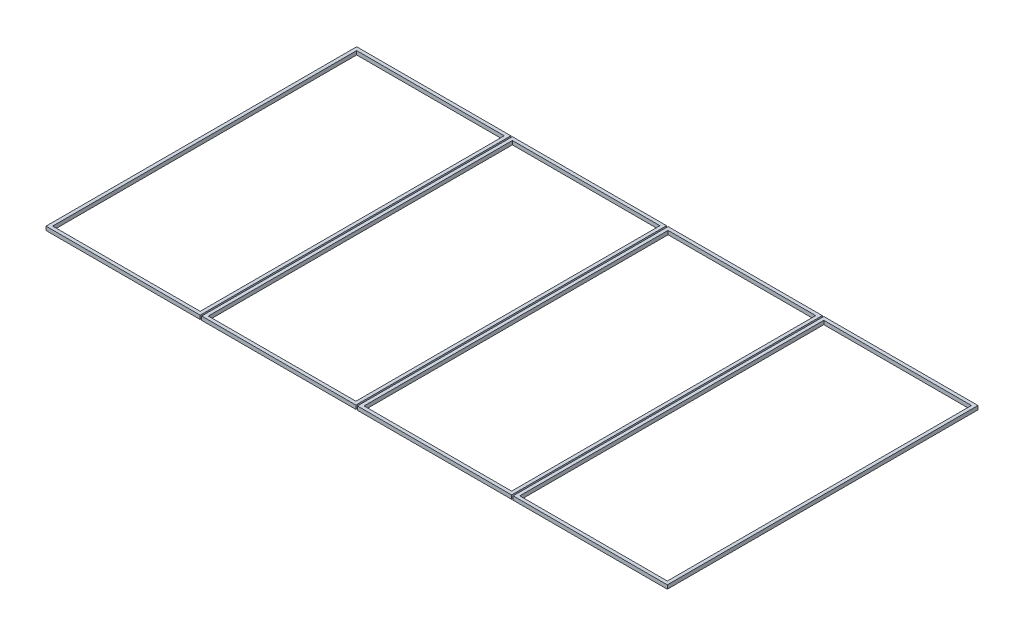
from build123d import *

# Parameters (mm, degrees)
SKETCH1_W            = 579.5
SKETCH1_H            = 1194
BOSS_EXTRU_1_DEPTH   = 15
BOSS_EXTRU_1_2_DEPTH = 15
BOSS_EXTRU_1_3_DEPTH = 15
BOSS_EXTRU_1_4_DEPTH = 15


with BuildPart() as part:
    # Sketch1 → Boss.-Extru.1 (new body)
    with BuildSketch(Plane(origin=(0, 0, 0), x_dir=(1, 0, 0), z_dir=(0, 1, 0))):
        Polygon((0, 0), (0, 1220), (605.5, 1220), (605.5, 0), (592.5, 0), (13, 0), align=None)
        with Locations((302.75, 610)):
            Rectangle(SKETCH1_W, SKETCH1_H, mode=Mode.SUBTRACT)
    extrude(amount=BOSS_EXTRU_1_DEPTH)


with BuildPart() as body_2:
    # Sketch1 → Boss.-Extru.1 2 (new body)
    with BuildSketch(Plane(origin=(0, 0, 0), x_dir=(1, 0, 0), z_dir=(0, 1, 0))):
        Polygon((2440, 0), (2440, 1220), (1834.5, 1220), (1834.5, 0), (1847.5, 0), (2427, 0), align=None)
        with Locations((2137.25, 610)):
            Rectangle(SKETCH1_W, SKETCH1_H, mode=Mode.SUBTRACT)
    extrude(amount=BOSS_EXTRU_1_2_DEPTH)


with BuildPart() as body_3:
    # Sketch1 → Boss.-Extru.1 3 (new body)
    with BuildSketch(Plane(origin=(0, 0, 0), x_dir=(1, 0, 0), z_dir=(0, 1, 0))):
        Polygon((624.5, 0), (1204, 0), (1217, 0), (1217, 1220), (611.5, 1220), (611.5, 0), align=None)
        with Locations((914.25, 610)):
            Rectangle(SKETCH1_W, SKETCH1_H, mode=Mode.SUBTRACT)
    extrude(amount=BOSS_EXTRU_1_3_DEPTH)


with BuildPart() as body_4:
    # Sketch1 → Boss.-Extru.1 4 (new body)
    with BuildSketch(Plane(origin=(0, 0, 0), x_dir=(1, 0, 0), z_dir=(0, 1, 0))):
        Polygon((1236, 0), (1815.5, 0), (1828.5, 0), (1828.5, 1220), (1223, 1220), (1223, 0), align=None)
        with Locations((1525.75, 610)):
            Rectangle(SKETCH1_W, SKETCH1_H, mode=Mode.SUBTRACT)
    extrude(amount=BOSS_EXTRU_1_4_DEPTH)


solid = Compound([part.part, body_2.part, body_3.part, body_4.part])
